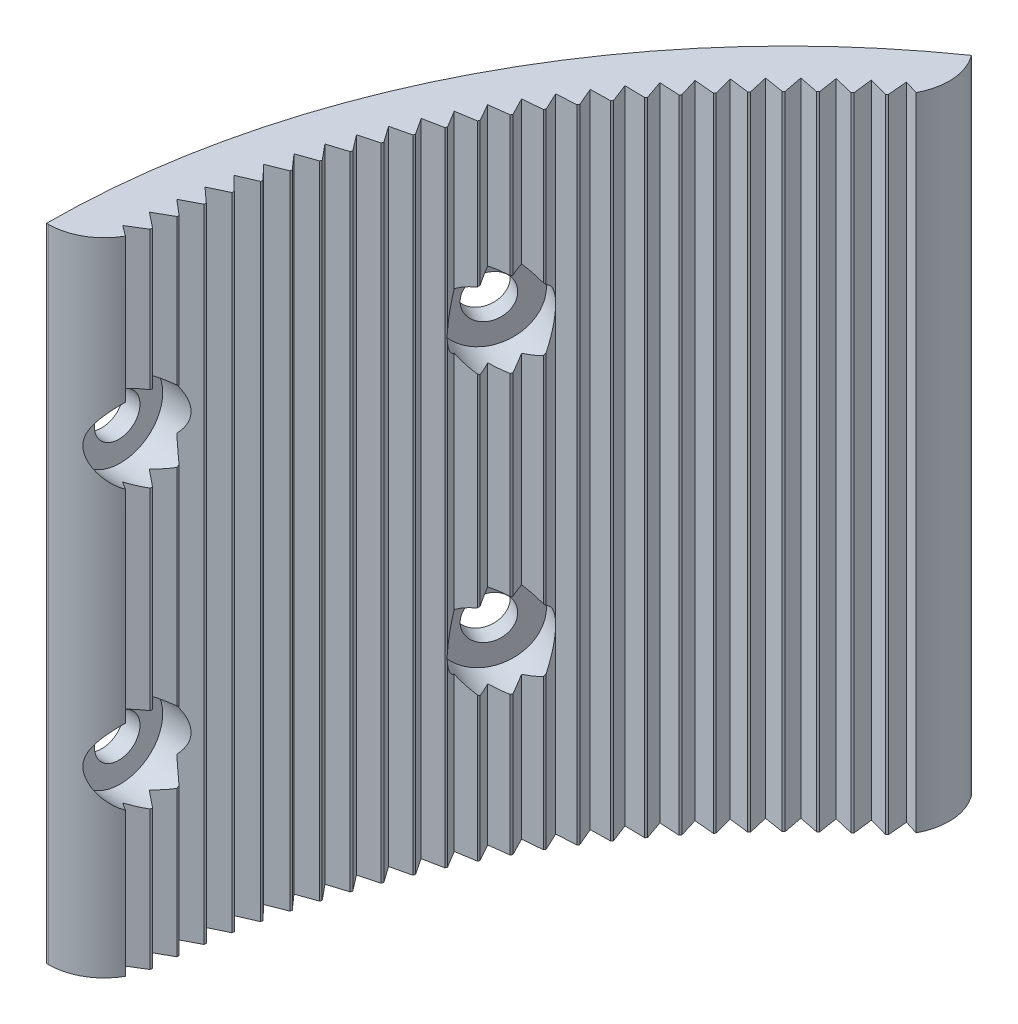
from build123d import *

# Parameters (mm, degrees)
BOSS_EXTRUDE1_DEPTH     = 34.6
CUT_EXTRUDE2_DEPTH      = 7
CUT_EXTRUDE2_DEPTH_BACK = 8
SKETCH2_R               = 1.15
CUT_EXTRUDE3_DEPTH      = 8
CUT_EXTRUDE3_DEPTH_BACK = 8
FILLET1_R               = 3
CUT_EXTRUDE4_DEPTH      = 34.6
CUT_EXTRUDE5_DEPTH      = 30
CUT_EXTRUDE5_DEPTH_BACK = 2
CUT_EXTRUDE6_DEPTH      = 30
CUT_EXTRUDE6_DEPTH_BACK = 2
SKETCH2_3_R             = 2.3


with BuildPart() as part:
    # Sketch1 → Boss-Extrude1 (new body)
    with BuildSketch(Plane(origin=(0, 0, 0), x_dir=(1, 0, 0), z_dir=(0, 1, 0))):
        with BuildLine():
            Line((-37, 0), (-40, 0))
            ThreePointArc((-40, 0), (-35.464771253, 18.5), (-22.8875, 32.804913409))
            Line((-22.8875, 32.804913409), (-21.1709375, 30.344544903))
            ThreePointArc((-21.1709375, 30.344544903), (-32.804913409, 17.1125), (-37, 0))
        make_face()
    extrude(amount=BOSS_EXTRUDE1_DEPTH)

    # Sketch2 → Cut-Extrude2 (cut, two sides: drawn at the far end of the back side and taken through both)
    with BuildSketch(Plane(origin=(-36.90986986, 0, -2.580989529), x_dir=(0, -1, 0), z_dir=(0.9975640502598243, 0, 0.06975647374412547)).offset(-CUT_EXTRUDE2_DEPTH_BACK)):
        with BuildLine():
            ThreePointArc((-10.95, 0), (-9.8, -1.15), (-8.65, 0))
            Line((-8.65, 0), (-10.95, 0))
        make_face()
        with BuildLine():
            Line((-10.95, 0), (-8.65, 0))
            ThreePointArc((-8.65, 0), (-9.8, 1.15), (-10.95, 0))
        make_face()
        with Locations(Location((-24.8, 0, 0), (0, 0, 270))):
            Circle(SKETCH2_R)
    extrude(amount=CUT_EXTRUDE2_DEPTH + CUT_EXTRUDE2_DEPTH_BACK, mode=Mode.SUBTRACT)

    # Sketch3 → Cut-Extrude3 (cut, two sides: drawn at the far end of the back side and taken through both)
    with BuildSketch(Plane(origin=(-32.669060936, 0, -17.370447823), x_dir=(0, -1, 0), z_dir=(0.8829475928589264, 0, 0.4694715627858917)).offset(-CUT_EXTRUDE3_DEPTH_BACK)):
        with BuildLine():
            ThreePointArc((-25.95, 0), (-24.8, -1.15), (-23.65, 0))
            Line((-23.65, 0), (-25.95, 0))
        make_face()
        with BuildLine():
            Line((-25.95, 0), (-23.65, 0))
            ThreePointArc((-23.65, 0), (-24.8, 1.15), (-25.95, 0))
        make_face()
        with BuildLine():
            ThreePointArc((-10.95, 0), (-9.8, -1.15), (-8.65, 0))
            Line((-8.65, 0), (-10.95, 0))
        make_face()
        with BuildLine():
            Line((-10.95, 0), (-8.65, 0))
            ThreePointArc((-8.65, 0), (-9.8, 1.15), (-10.95, 0))
        make_face()
    extrude(amount=CUT_EXTRUDE3_DEPTH + CUT_EXTRUDE3_DEPTH_BACK, mode=Mode.SUBTRACT)

    # Fillet1
    # the kernel refuses this fillet: 3 mm, written as the material it takes off along each edge
    with BuildSketch(Plane(origin=(-37, -7.218353376, 0), x_dir=(0.03752643229141178, 0, -0.9992956353749766), z_dir=(0, 1, 0))) as fillet1_piece_1:
        with BuildLine():
            CenterArc((2.889535286, 2.997886906), FILLET1_R, 182.150611152, 85.698777695)
            Line((-0.10835162, 2.885307609), (0, 0))
            ThreePointArc((0, 0), (1.388477995, 0.026061491), (2.77695599, 0))
        make_face()
    extrude(amount=49.036706752, mode=Mode.SUBTRACT)
    with BuildSketch(Plane(origin=(-21.1709375, -7.218353376, -30.344544903), x_dir=(-0.7980730142265803, 0, 0.6025607554125151), z_dir=(0, 1, 0))) as fillet1_piece_2:
        with BuildLine():
            CenterArc((2.889535286, -2.997886906), FILLET1_R, 92.150611152, 85.698777695)
            Line((-0.10835162, -2.885307609), (0, 0))
            ThreePointArc((0, 0), (1.388477995, -0.026061491), (2.77695599, 0))
        make_face()
    extrude(amount=49.036706752, mode=Mode.SUBTRACT)

    # Sketch1<3> → Cut-Extrude4 (cut)
    with BuildSketch(Plane(origin=(0, 0, 0), x_dir=(1, 0, 0), z_dir=(0, 1, 0))):
        with BuildLine():
            ThreePointArc((-24.311652199, 27.89163974), (-23.854067081, 28.283979276), (-23.39015141, 28.66881262))
            Line((-23.39015141, 28.66881262), (-24.439165639, 28.955781553))
            Line((-24.439165639, 28.955781553), (-24.311652199, 27.89163974))
        make_face()
        with BuildLine():
            ThreePointArc((-25.288382841, 27.00921497), (-24.845042954, 27.417582691), (-24.395109521, 27.81867415))
            Line((-24.395109521, 27.81867415), (-25.453667495, 28.068147668))
            Line((-25.453667495, 28.068147668), (-25.288382841, 27.00921497))
        make_face()
        with BuildLine():
            ThreePointArc((-26.233107217, 26.092605959), (-25.804573673, 26.516485015), (-25.369191937, 26.933326947))
            Line((-25.369191937, 26.933326947), (-26.435953892, 27.144989304))
            Line((-26.435953892, 27.144989304), (-26.233107217, 26.092605959))
        make_face()
        with BuildLine():
            ThreePointArc((-27.144629634, 25.142972816), (-26.731444808, 25.581826723), (-26.311165811, 26.013891552))
            Line((-26.311165811, 26.013891552), (-27.384781597, 26.187474856))
            Line((-27.384781597, 26.187474856), (-27.144629634, 25.142972816))
        make_face()
        with BuildLine():
            ThreePointArc((-28.021796423, 24.161517444), (-27.624483263, 24.614790766), (-27.21983893, 25.061531649))
            Line((-27.21983893, 25.061531649), (-28.298949726, 25.196816205))
            Line((-28.298949726, 25.196816205), (-28.021796423, 24.161517444))
        make_face()
        with BuildLine():
            ThreePointArc((-28.863497398, 23.149482024), (-28.482558763, 23.616601075), (-28.094061234, 24.077452594))
            Line((-28.094061234, 24.077452594), (-29.177301261, 24.174267178))
            Line((-29.177301261, 24.174267178), (-28.863497398, 23.149482024))
        make_face()
        with BuildLine():
            ThreePointArc((-29.668667258, 22.108147438), (-29.304585283, 22.588521009), (-28.93272626, 23.062899886))
            Line((-28.93272626, 23.062899886), (-30.018724516, 23.121121965))
            Line((-30.018724516, 23.121121965), (-29.668667258, 22.108147438))
        make_face()
        with BuildLine():
            ThreePointArc((-30.43628694, 21.038831653), (-30.089522426, 21.531851759), (-29.734772553, 22.019157596))
            Line((-29.734772553, 22.019157596), (-30.822154541, 22.038713482))
            Line((-30.822154541, 22.038713482), (-30.43628694, 21.038831653))
        make_face()
        with BuildLine():
            ThreePointArc((-31.855038368, 18.82170371), (-31.544202953, 19.338129694), (-31.224996124, 19.849423595))
            Line((-31.224996124, 19.849423595), (-32.311016831, 19.791621809))
            Line((-32.311016831, 19.791621809), (-31.855038368, 18.82170371))
        make_face()
        with BuildLine():
            ThreePointArc((-32.504374471, 17.676697663), (-32.212105218, 18.203853367), (-31.9112873, 18.726178009))
            Line((-31.9112873, 18.726178009), (-32.994564715, 18.629782655))
            Line((-32.994564715, 18.629782655), (-32.504374471, 17.676697663))
        make_face()
        with BuildLine():
            Line((-33.636352995, 17.444364697), (-33.112571379, 16.509319085))
            ThreePointArc((-33.112571379, 16.509319085), (-32.839238201, 17.046537314), (-32.557189924, 17.579231618))
            Line((-32.557189924, 17.579231618), (-33.636352995, 17.444364697))
        make_face()
        with BuildLine():
            Line((-34.235569391, 16.236868261), (-33.678859329, 15.321045471))
            ThreePointArc((-33.678859329, 15.321045471), (-33.424808168, 15.867646294), (-33.161886507, 16.410036054))
            Line((-33.161886507, 16.410036054), (-34.235569391, 16.236868261))
        make_face()
        with BuildLine():
            Line((-34.791455505, 15.008821617), (-34.202521596, 14.11338076))
            ThreePointArc((-34.202521596, 14.11338076), (-33.968073994, 14.668672372), (-33.724611715, 15.220071112))
            Line((-33.724611715, 15.220071112), (-34.791455505, 15.008821617))
        make_face()
        with BuildLine():
            Line((-35.303307778, 13.761779043), (-34.682895407, 12.887853435))
            ThreePointArc((-34.682895407, 12.887853435), (-34.468348092, 13.45113303), (-34.244653335, 14.010842872))
            Line((-34.244653335, 14.010842872), (-35.303307778, 13.761779043))
        make_face()
        with BuildLine():
            Line((-36.192376048, 11.217041431), (-35.511401278, 10.389435946))
            ThreePointArc((-35.511401278, 10.389435946), (-35.337443633, 10.966543553), (-35.154107899, 11.540740784))
            Line((-35.154107899, 11.540740784), (-36.192376048, 11.217041431))
        make_face()
        with BuildLine():
            Line((-36.568466795, 9.922567144), (-35.858484738, 9.119707906))
            ThreePointArc((-35.858484738, 9.119707906), (-35.705165103, 9.70263804), (-35.542369791, 10.282993223))
            Line((-35.542369791, 10.282993223), (-36.568466795, 9.922567144))
        make_face()
        with BuildLine():
            Line((-36.898274626, 8.615534349), (-36.160183871, 7.838437499))
            ThreePointArc((-36.160183871, 7.838437499), (-36.027696296, 8.426452375), (-35.885647448, 9.012230982))
            Line((-35.885647448, 9.012230982), (-36.898274626, 8.615534349))
        make_face()
        with BuildLine():
            Line((-37.181382118, 7.297597294), (-36.416116831, 6.547246365))
            ThreePointArc((-36.416116831, 6.547246365), (-36.304628998, 7.139601761), (-36.183506398, 7.730062402))
            Line((-36.183506398, 7.730062402), (-37.181382118, 7.297597294))
        make_face()
        with BuildLine():
            Line((-37.417430957, 5.970424029), (-36.625959696, 5.247768703))
            ThreePointArc((-36.625959696, 5.247768703), (-36.53561271, 5.843714903), (-36.435569658, 6.43811026))
            Line((-36.435569658, 6.43811026), (-37.417430957, 5.970424029))
        make_face()
        with BuildLine():
            Line((-37.606122386, 4.63569429), (-36.789446878, 3.941649196))
            ThreePointArc((-36.789446878, 3.941649196), (-36.720355088, 4.540431942), (-36.641518202, 5.138009717))
            Line((-36.641518202, 5.138009717), (-37.606122386, 4.63569429))
        make_face()
        with BuildLine():
            Line((-37.747217589, 3.29509738), (-36.90637146, 2.630540938))
            ThreePointArc((-36.90637146, 2.630540938), (-36.858622311, 3.231402379), (-36.801091372, 3.831406248))
            Line((-36.801091372, 3.831406248), (-37.747217589, 3.29509738))
        make_face()
        with BuildLine():
            Line((-37.840537989, 1.950330027), (-36.976585456, 1.316103333))
            ThreePointArc((-36.976585456, 1.316103333), (-36.950239382, 1.918282987), (-36.914087204, 2.519953555))
            Line((-36.914087204, 2.519953555), (-37.840537989, 1.950330027))
        make_face()
        Polygon((-22.35558953, 29.482666378), (-23.393732327, 29.806767525), (-23.304151489, 28.738763428), align=None)
        Polygon((-30.499185001, 20.947546737), (-31.586574476, 20.928411678), (-31.165384904, 19.94288805), align=None)
        Polygon((-35.770478384, 12.497318859), (-35.119372777, 11.646014586), (-34.721353174, 12.783881794), align=None)
    extrude(amount=CUT_EXTRUDE4_DEPTH, mode=Mode.SUBTRACT)


with BuildPart() as cut_extrude4_kept_piece:
    # of the separate pieces the step leaves, the one the design keeps (cut_extrude4_pieces_kept)
    add(part.part.solids().sort_by_distance((-23.387151137, 0, -28.671260204))[0])

    # Sketch3<3> → Cut-Extrude5 (cut, two sides: drawn at the far end of the back side and taken through both)
    with BuildSketch(Plane(origin=(-32.669060936, 0, -17.370447823), x_dir=(0, -1, 0), z_dir=(0.8829475928589264, 0, 0.4694715627858917)).offset(-CUT_EXTRUDE5_DEPTH_BACK)):
        with BuildLine():
            ThreePointArc((-27.1, 0), (-24.8, -2.3), (-22.5, 0))
            Line((-22.5, 0), (-23.65, 0))
            ThreePointArc((-23.65, 0), (-24.8, -1.15), (-25.95, 0))
            Line((-25.95, 0), (-27.1, 0))
        make_face()
        with BuildLine():
            Line((-23.65, 0), (-22.5, 0))
            ThreePointArc((-22.5, 0), (-24.8, 2.3), (-27.1, 0))
            Line((-27.1, 0), (-25.95, 0))
            ThreePointArc((-25.95, 0), (-24.8, 1.15), (-23.65, 0))
        make_face()
        with BuildLine():
            ThreePointArc((-12.1, 0), (-9.8, -2.3), (-7.5, 0))
            Line((-7.5, 0), (-8.65, 0))
            ThreePointArc((-8.65, 0), (-9.8, -1.15), (-10.95, 0))
            Line((-10.95, 0), (-12.1, 0))
        make_face()
        with BuildLine():
            Line((-8.65, 0), (-7.5, 0))
            ThreePointArc((-7.5, 0), (-9.8, 2.3), (-12.1, 0))
            Line((-12.1, 0), (-10.95, 0))
            ThreePointArc((-10.95, 0), (-9.8, 1.15), (-8.65, 0))
        make_face()
    extrude(amount=CUT_EXTRUDE5_DEPTH + CUT_EXTRUDE5_DEPTH_BACK, mode=Mode.SUBTRACT)

    # Sketch2<3> → Cut-Extrude6 (cut, two sides: drawn at the far end of the back side and taken through both)
    with BuildSketch(Plane(origin=(-36.90986986, 0, -2.580989529), x_dir=(0, -1, 0), z_dir=(0.9975640502598243, 0, 0.06975647374412547)).offset(-CUT_EXTRUDE6_DEPTH_BACK)):
        with Locations(Location((-24.8, 0, 0), (0, 0, 207.764560661))):
            Circle(SKETCH2_3_R)
        with Locations(Location((-9.8, 0, 0), (0, 0, 207.764560661))):
            Circle(SKETCH2_3_R)
    extrude(amount=CUT_EXTRUDE6_DEPTH + CUT_EXTRUDE6_DEPTH_BACK, mode=Mode.SUBTRACT)


solid = cut_extrude4_kept_piece.part
